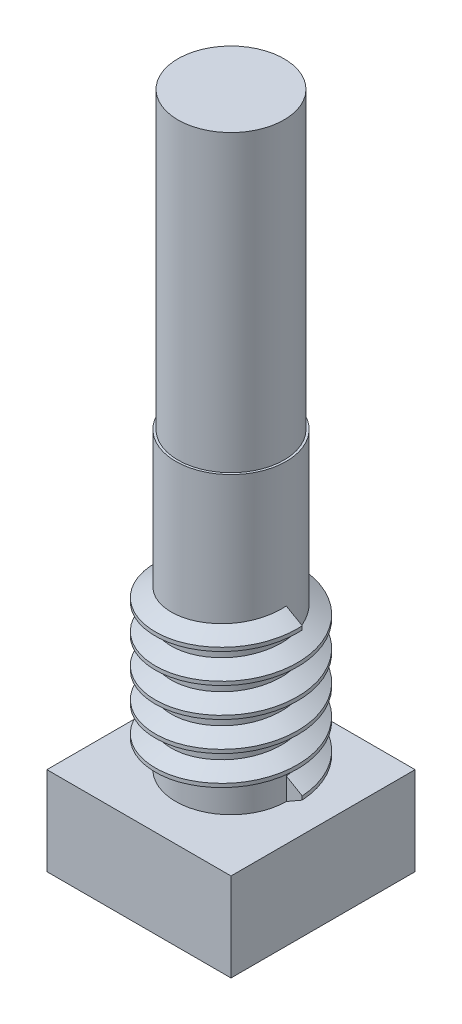
from build123d import *
from build123d.topology import SkipClean

# Parameters (mm, degrees)
SKETCH2_W           = 7.9375
SKETCH2_H           = 7.9375
BOSS_EXTRUDE1_DEPTH = 3.81
SKETCH3_R           = 2.38252
BOSS_EXTRUDE2_DEPTH = 25.4
THREAD2_PITCH       = 1.27
SKETCH4_OUTSIDE_W   = 16.196
SKETCH4_OUTSIDE_H   = 16.196
SKETCH4_OUTSIDE_R   = 2.286
CUT_EXTRUDE1_DEPTH  = 12.7


with BuildPart() as part:
    # Sketch2 → Boss-Extrude1 (new body)
    with BuildSketch(Plane(origin=(0, 0, 0), x_dir=(1, 0, 0), z_dir=(0, 1, 0))):
        Rectangle(SKETCH2_W, SKETCH2_H)
    extrude(amount=BOSS_EXTRUDE1_DEPTH)

    # Sketch3 → Boss-Extrude2 (add)
    with BuildSketch(Plane(origin=(0, 3.81, 0), x_dir=(1, 0, 0), z_dir=(0, 1, 0))):
        with Locations(Location((0, 0, 0), (0, 0, 270))):
            Circle(SKETCH3_R)
    extrude(amount=BOSS_EXTRUDE2_DEPTH)

    # Thread2: the profile of Thread Profile2 profile screwed along a right-hand helix of 5 turns, 8 arcs to a turn; built about Z, then put on its axis
    with SkipClean():  # the faces are left unmerged after this step: merging them gives an invalid solid
        thread2_z = Axis((0, 0, 0), (0, 0, 1))
        thread2_corners = [(2.38222, 0, -0.000173205), (3.069927661, 0, 0.396874998), (3.069927661, 0, 0.555624998), (2.38222, 0, 0.952673202)]
        with BuildLine(mode=Mode.PRIVATE) as thread2_profile:
            Line(thread2_corners[0], thread2_corners[1])
            Line(thread2_corners[1], thread2_corners[2])
            Line(thread2_corners[2], thread2_corners[3])
            Line(thread2_corners[3], thread2_corners[0])
        thread2_cap = Face(thread2_profile.wire())
        thread2_turn_angles = [0, 22.5, 45, 67.5, 90, 112.5, 135, 157.5, 180, 202.5, 225, 247.5, 270, 292.5, 315, 337.5, 360]
        thread2_turn_weights = [1, 0.9238795325112867, 1, 0.9238795325112867, 1, 0.9238795325112867, 1, 0.9238795325112867, 1, 0.9238795325112867, 1, 0.9238795325112867, 1, 0.9238795325112867, 1, 0.9238795325112867, 1]
        thread2_turn_rails = [Edge.make_bspline([Vector(p[0], p[1], 0).rotate(thread2_z, thread2_turn_angles[k]) / thread2_turn_weights[k] + Vector(0, 0, p[2] + THREAD2_PITCH * thread2_turn_angles[k] / 360) for k in range(17)], [0, 0, 0, 1, 1, 2, 2, 3, 3, 4, 4, 5, 5, 6, 6, 7, 7, 8, 8, 8], 2, thread2_turn_weights) for p in thread2_corners]
        thread2_turn_sides = [Face.make_surface_from_curves(thread2_turn_rails[p[0]], thread2_turn_rails[p[1]]) for p in [(0, 1), (1, 2), (2, 3), (3, 0)]]
        thread2 = Plane(origin=(0, 3.81, 0), x_dir=(1, 0, 0), z_dir=(0, 1, 0)) * Solid(Shell([*[p.moved(Location((0, 0, THREAD2_PITCH * i))) for i in range(5) for p in thread2_turn_sides], thread2_cap, thread2_cap.rotate(thread2_z, 1800).moved(Location((0, 0, THREAD2_PITCH * 1800 / 360)))]))
        add(thread2)

    # Sketch4 outside → Cut-Extrude1 (cut)
    with SkipClean():  # the faces are left unmerged after this step: merging them gives an invalid solid
        with BuildSketch(Plane(origin=(0, 29.21, 0), x_dir=(1, 0, 0), z_dir=(0, 1, 0))):
            Rectangle(SKETCH4_OUTSIDE_W, SKETCH4_OUTSIDE_H)
            with Locations(Location((0, 0, 0), (0, 0, 270))):
                Circle(SKETCH4_OUTSIDE_R, mode=Mode.SUBTRACT)
        extrude(amount=-CUT_EXTRUDE1_DEPTH, mode=Mode.SUBTRACT)


solid = part.part
